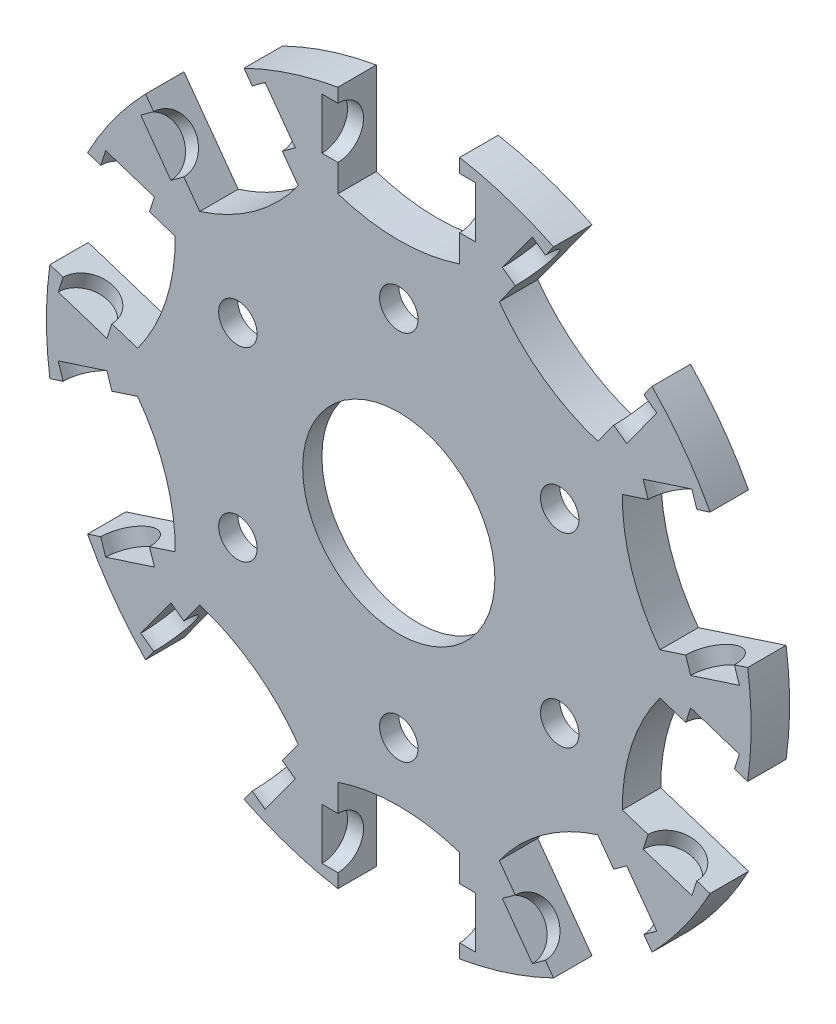
from build123d import *

# Parameters (mm, degrees)
SKETCH2_R           = 1.5
SKETCH2_R_2         = 7.5
BOSS_EXTRUDE2_DEPTH = 3
SKETCH2_4_R         = 18.75
SKETCH2_4_R_2       = 1.5
SKETCH2_4_R_3       = 7.5
BOSS_EXTRUDE3_DEPTH = 3
SKETCH3_W           = 12
SKETCH3_H           = 2
CIRPATTERN1_COUNT   = 10
SKETCH5_R           = 18.75
CUT_EXTRUDE2_DEPTH  = 1.5


with BuildPart() as part:
    # Sketch2 → Boss-Extrude2 (new body)
    with BuildSketch(Plane.XY):
        with BuildLine():
            Line((-4.75, 19.886666462), (-4.75, 27.086666462))
            ThreePointArc((-4.75, 27.086666462), (-8.497967345, 26.154054198), (-12.078312357, 24.705553437))
            Line((-12.078312357, 24.705553437), (-7.84625854, 18.880631077))
            ThreePointArc((-7.84625854, 18.880631077), (-11.235350363, 15.46413311), (-15.531919987, 13.29667118))
            Line((-15.531919987, 13.29667118), (-19.763973803, 19.12159354))
            ThreePointArc((-19.763973803, 19.12159354), (-22.247967345, 16.164094438), (-24.29311992, 12.88775871))
            Line((-24.29311992, 12.88775871), (-17.445513002, 10.66283635))
            ThreePointArc((-17.445513002, 10.66283635), (-18.179178763, 5.906773241), (-20.381174449, 1.627799446))
            Line((-20.381174449, 1.627799446), (-27.228781366, 3.852721805))
            ThreePointArc((-27.228781366, 3.852721805), (-27.5, 0), (-27.228781366, -3.852721805))
            Line((-27.228781366, -3.852721805), (-20.381174449, -1.627799446))
            ThreePointArc((-20.381174449, -1.627799446), (-18.179178763, -5.906773241), (-17.445513002, -10.66283635))
            Line((-17.445513002, -10.66283635), (-24.29311992, -12.88775871))
            ThreePointArc((-24.29311992, -12.88775871), (-22.247967345, -16.164094438), (-19.763973803, -19.12159354))
            Line((-19.763973803, -19.12159354), (-15.531919987, -13.29667118))
            ThreePointArc((-15.531919987, -13.29667118), (-11.235350363, -15.46413311), (-7.84625854, -18.880631077))
            Line((-7.84625854, -18.880631077), (-12.078312357, -24.705553437))
            ThreePointArc((-12.078312357, -24.705553437), (-8.497967345, -26.154054198), (-4.75, -27.086666462))
            Line((-4.75, -27.086666462), (-4.75, -19.886666462))
            ThreePointArc((-4.75, -19.886666462), (0, -19.114719737), (4.75, -19.886666462))
            Line((4.75, -19.886666462), (4.75, -27.086666462))
            ThreePointArc((4.75, -27.086666462), (8.497967345, -26.154054198), (12.078312357, -24.705553437))
            Line((12.078312357, -24.705553437), (7.84625854, -18.880631077))
            ThreePointArc((7.84625854, -18.880631077), (11.235350363, -15.46413311), (15.531919987, -13.29667118))
            Line((15.531919987, -13.29667118), (19.763973803, -19.12159354))
            ThreePointArc((19.763973803, -19.12159354), (22.247967345, -16.164094438), (24.29311992, -12.88775871))
            Line((24.29311992, -12.88775871), (17.445513002, -10.66283635))
            ThreePointArc((17.445513002, -10.66283635), (18.179178763, -5.906773241), (20.381174449, -1.627799446))
            Line((20.381174449, -1.627799446), (27.228781366, -3.852721805))
            ThreePointArc((27.228781366, -3.852721805), (27.5, 0), (27.228781366, 3.852721805))
            Line((27.228781366, 3.852721805), (20.381174449, 1.627799446))
            ThreePointArc((20.381174449, 1.627799446), (18.179178763, 5.906773241), (17.445513002, 10.66283635))
            Line((17.445513002, 10.66283635), (24.29311992, 12.88775871))
            ThreePointArc((24.29311992, 12.88775871), (22.247967345, 16.164094438), (19.763973803, 19.12159354))
            Line((19.763973803, 19.12159354), (15.531919987, 13.29667118))
            ThreePointArc((15.531919987, 13.29667118), (11.235350363, 15.46413311), (7.84625854, 18.880631077))
            Line((7.84625854, 18.880631077), (12.078312357, 24.705553437))
            ThreePointArc((12.078312357, 24.705553437), (8.497967345, 26.154054198), (4.75, 27.086666462))
            Line((4.75, 27.086666462), (4.75, 19.886666462))
            ThreePointArc((4.75, 19.886666462), (0, 19.114719737), (-4.75, 19.886666462))
        make_face()
        with Locations((0, 14.5)):
            Circle(SKETCH2_R, mode=Mode.SUBTRACT)
        with Locations((-12.557368355, -7.25)):
            Circle(SKETCH2_R, mode=Mode.SUBTRACT)
        with Locations((0, -14.5)):
            Circle(SKETCH2_R, mode=Mode.SUBTRACT)
        with Locations((12.557368355, -7.25)):
            Circle(SKETCH2_R, mode=Mode.SUBTRACT)
        with Locations((-12.557368355, 7.25)):
            Circle(SKETCH2_R, mode=Mode.SUBTRACT)
        Circle(SKETCH2_R_2, mode=Mode.SUBTRACT)
        with Locations((12.557368355, 7.25)):
            Circle(SKETCH2_R, mode=Mode.SUBTRACT)
    extrude(amount=BOSS_EXTRUDE2_DEPTH)

    # Sketch2<4> → Boss-Extrude3 (add)
    with BuildSketch(Plane.XY):
        Circle(SKETCH2_4_R)
        with Locations((-12.557368355, -7.25)):
            Circle(SKETCH2_4_R_2, mode=Mode.SUBTRACT)
        with Locations((0, -14.5)):
            Circle(SKETCH2_4_R_2, mode=Mode.SUBTRACT)
        with Locations((12.557368355, -7.25)):
            Circle(SKETCH2_4_R_2, mode=Mode.SUBTRACT)
        with Locations((-12.557368355, 7.25)):
            Circle(SKETCH2_4_R_2, mode=Mode.SUBTRACT)
        Circle(SKETCH2_4_R_3, mode=Mode.SUBTRACT)
        with Locations((12.557368355, 7.25)):
            Circle(SKETCH2_4_R_2, mode=Mode.SUBTRACT)
        with Locations((0, 14.5)):
            Circle(SKETCH2_4_R_2, mode=Mode.SUBTRACT)
    extrude(amount=BOSS_EXTRUDE3_DEPTH)

    # Sketch3 → Cut-Revolve1 (revolve, cut)
    with BuildSketch(Plane.XY.offset(3)):
        with Locations((0, 25)):
            Rectangle(SKETCH3_W, SKETCH3_H)
    cut_revolve1 = revolve(axis=Axis((6, 24, 3), (-1, 0, 0)), mode=Mode.SUBTRACT)

    # CirPattern1: Cut-Revolve1 ×10 about axis
    cirpattern1_axis = Axis((0, 0, 0), (0, 0, 1))
    for i in range(1, CIRPATTERN1_COUNT):
        add(cut_revolve1.rotate(cirpattern1_axis, i * 360 / CIRPATTERN1_COUNT), mode=Mode.SUBTRACT)

    # Sketch5 → Cut-Extrude2 (cut)
    with BuildSketch(Plane(origin=(0, 0, 0), x_dir=(-1, 0, 0), z_dir=(0, 0, -1))):
        Circle(SKETCH5_R)
    extrude(amount=-CUT_EXTRUDE2_DEPTH, mode=Mode.SUBTRACT)


solid = part.part
